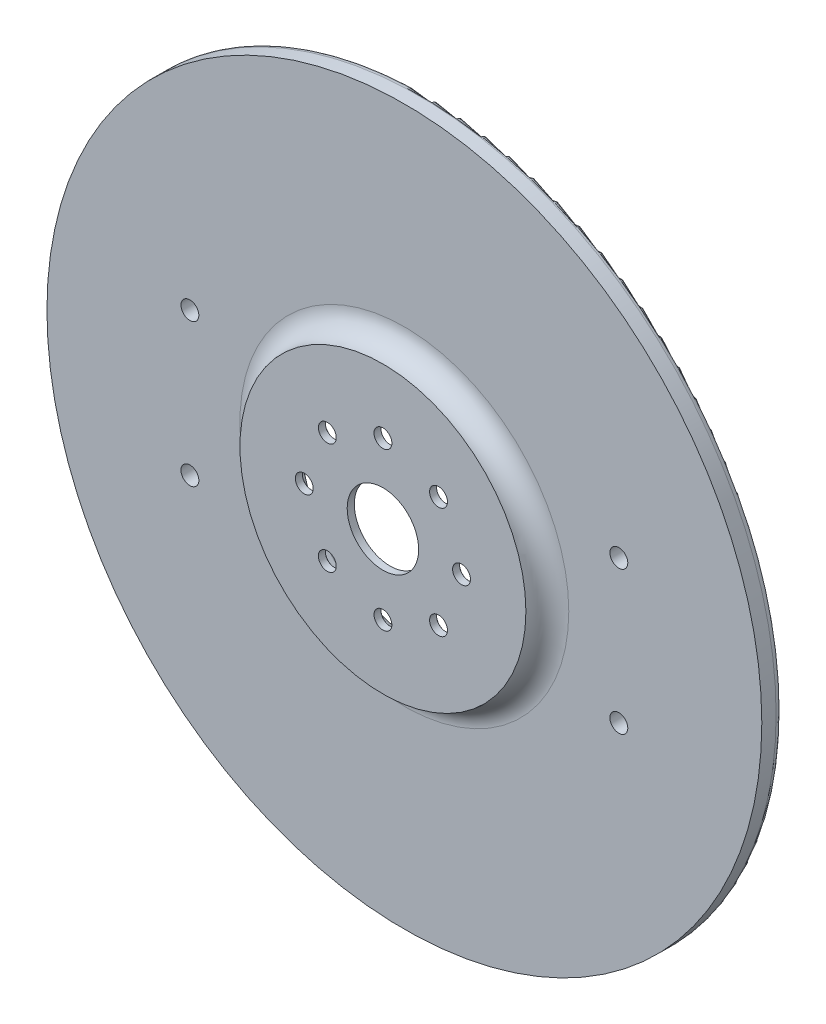
from build123d import *

# Parameters (mm, degrees)
SKETCH_1_R            = 50
EXTRUDE_1_DEPTH       = 3
F_2_5MM_1_D           = 2.5
F_2_5MM_1_CSINK_D     = 2.55
F_2_5MM_1_CSINK_ANGLE = 90
SKETCH_5_R            = 20
EXTRUDE_2_DEPTH       = 3
SKETCH_6_R            = 17
CUT_EXTRUDE_1_DEPTH   = 5
F_2_5MM_2_AT_2_COUNT  = 2
F_2_5MM_2_AT_2_PITCH  = 8.419035512
F_2_5MM_2_AT_3_COUNT  = 2
F_2_5MM_2_AT_3_PITCH  = 15.556349186
F_2_5MM_2_AT_4_COUNT  = 2
F_2_5MM_2_AT_4_PITCH  = 20.325349715
F_2_5MM_2_AT_5_COUNT  = 2
F_2_5MM_2_AT_5_PITCH  = 22
F_2_5MM_2_AT_6_COUNT  = 2
F_2_5MM_2_AT_6_PITCH  = 20.325349715
F_2_5MM_2_AT_7_COUNT  = 2
F_2_5MM_2_AT_7_PITCH  = 15.556349186
F_2_5MM_2_AT_8_COUNT  = 2
F_2_5MM_2_AT_8_PITCH  = 8.419035512
SKETCH_10_R           = 5
CUT_EXTRUDE_2_DEPTH   = 5
FILLET_1_R            = 1
FILLET_3_R            = 3


# Some blends are built 0.0001 mm under size
with BuildPart() as part:
    # 草图1 → 凸台-拉伸1 (new body)
    with BuildSketch(Plane.XY):
        Circle(SKETCH_1_R)
    extrude(amount=EXTRUDE_1_DEPTH)

    # Ø2.5mm 暗销孔1 (through all)
    with Locations(Plane(origin=(0, 0, 0), x_dir=(-1, 0, 0), z_dir=(0, 0, -1))):
        with Locations((-30, 10), (-30, -10), (30, -10), (30, 10)):
            CounterSinkHole(F_2_5MM_1_D / 2, F_2_5MM_1_CSINK_D / 2, counter_sink_angle=F_2_5MM_1_CSINK_ANGLE)

    # 草图5 → 凸台-拉伸2 (add)
    with BuildSketch(Plane.XY.offset(3)):
        Circle(SKETCH_5_R)
    extrude(amount=EXTRUDE_2_DEPTH)

    # 草图6 → 切除-拉伸1 (cut)
    with BuildSketch(Plane(origin=(0, 0, 0), x_dir=(-1, 0, 0), z_dir=(0, 0, -1))):
        Circle(SKETCH_6_R)
    extrude(amount=-CUT_EXTRUDE_1_DEPTH, mode=Mode.SUBTRACT)

    # 草图9 → Ø2.5mm 暗销孔2 (revolve, cut)
    with BuildSketch(Plane(origin=(11, 0, 5), x_dir=(0, 1, 0), z_dir=(1, 0, 0))):
        Polygon((0, 0), (0, 1), (1.25, 1), (1.25, 0.025), (1.275, 0), align=None)
    f_2_5mm_2 = revolve(axis=Axis((11, 0, -1.35), (0, 0, 1)), mode=Mode.SUBTRACT)

    # Ø2.5mm 暗销孔2 at 2: Ø2.5mm 暗销孔2 ×2
    with Locations(*[Vector(-0.38268343236200486, 0.9238795325125646, 0) * (i * F_2_5MM_2_AT_2_PITCH) for i in range(1, F_2_5MM_2_AT_2_COUNT)]):
        add(f_2_5mm_2, mode=Mode.SUBTRACT)

    # Ø2.5mm 暗销孔2 at 3: Ø2.5mm 暗销孔2 ×2
    with Locations(*[Vector(-0.7071067811841869, 0.7071067811889081, 0) * (i * F_2_5MM_2_AT_3_PITCH) for i in range(1, F_2_5MM_2_AT_3_COUNT)]):
        add(f_2_5mm_2, mode=Mode.SUBTRACT)

    # Ø2.5mm 暗销孔2 at 4: Ø2.5mm 暗销孔2 ×2
    with Locations(*[Vector(-0.9238795325100095, 0.3826834323681732, 0) * (i * F_2_5MM_2_AT_4_PITCH) for i in range(1, F_2_5MM_2_AT_4_COUNT)]):
        add(f_2_5mm_2, mode=Mode.SUBTRACT)

    # Ø2.5mm 暗销孔2 at 5: Ø2.5mm 暗销孔2 ×2
    with Locations(*[(-i * F_2_5MM_2_AT_5_PITCH, 0, 0) for i in range(1, F_2_5MM_2_AT_5_COUNT)]):
        add(f_2_5mm_2, mode=Mode.SUBTRACT)

    # Ø2.5mm 暗销孔2 at 6: Ø2.5mm 暗销孔2 ×2
    with Locations(*[Vector(-0.9238795325125633, -0.38268343236200797, 0) * (i * F_2_5MM_2_AT_6_PITCH) for i in range(1, F_2_5MM_2_AT_6_COUNT)]):
        add(f_2_5mm_2, mode=Mode.SUBTRACT)

    # Ø2.5mm 暗销孔2 at 7: Ø2.5mm 暗销孔2 ×2
    with Locations(*[Vector(-0.7071067811889058, -0.7071067811841893, 0) * (i * F_2_5MM_2_AT_7_PITCH) for i in range(1, F_2_5MM_2_AT_7_COUNT)]):
        add(f_2_5mm_2, mode=Mode.SUBTRACT)

    # Ø2.5mm 暗销孔2 at 8: Ø2.5mm 暗销孔2 ×2
    with Locations(*[Vector(-0.3826834323681702, -0.9238795325100109, 0) * (i * F_2_5MM_2_AT_8_PITCH) for i in range(1, F_2_5MM_2_AT_8_COUNT)]):
        add(f_2_5mm_2, mode=Mode.SUBTRACT)

    # 草图10 → 切除-拉伸2 (cut)
    with BuildSketch(Plane(origin=(0, 0, 5), x_dir=(-1, 0, 0), z_dir=(0, 0, -1))):
        Circle(SKETCH_10_R)
    extrude(amount=-CUT_EXTRUDE_2_DEPTH, mode=Mode.SUBTRACT)

    # 圆角1
    # the kernel refuses this fillet: 1 mm, written as the material it takes off along each edge
    with BuildSketch(Plane(origin=(-30, -10, 0), x_dir=(1, 0, 0), z_dir=(0, -1, 0))) as fillet_1_piece_1:
        with BuildLine():
            CenterArc((1.47220486, 1), FILLET_1_R, 257.161431859, 12.838568141)
            Line((1.25, 0.025), (1.245555903, 0.0055))
            ThreePointArc((1.245555903, 0.0055), (1.248357864, -0.001642136), (1.260857864, -0.014142136))
            Line((1.260857864, -0.014142136), (1.275, -0.02))
            Line((1.275, -0.02), (1.47220486, -0.02))
            Line((1.47220486, -0.02), (1.47220486, 0))
        make_face()
    revolve(axis=Axis((-30, -10, 0), (0, 0, 1)), mode=Mode.SUBTRACT)
    with BuildSketch(Plane(origin=(0, 0, 0), x_dir=(1, 0, 0), z_dir=(0, -1, 0))) as fillet_1_piece_2:
        with BuildLine():
            CenterArc((50 - FILLET_1_R, FILLET_1_R), FILLET_1_R, 270, 90)
            Line((50 - FILLET_1_R, 0), (50 - FILLET_1_R, -FILLET_1_R * 0.02))
            Line((50 - FILLET_1_R, -FILLET_1_R * 0.02), (50 + FILLET_1_R * 0.02, -FILLET_1_R * 0.02))
            Line((50 + FILLET_1_R * 0.02, -FILLET_1_R * 0.02), (50 + FILLET_1_R * 0.02, FILLET_1_R))
            Line((50 + FILLET_1_R * 0.02, FILLET_1_R), (50, FILLET_1_R))
        make_face()
    revolve(axis=Axis((0, 0, 0), (0, 0, 1)), mode=Mode.SUBTRACT)
    with BuildSketch(Plane(origin=(30, -10, 0), x_dir=(1, 0, 0), z_dir=(0, -1, 0))) as fillet_1_piece_3:
        with BuildLine():
            CenterArc((1.47220486, 1), FILLET_1_R, 257.161431859, 12.838568141)
            Line((1.25, 0.025), (1.245555903, 0.0055))
            ThreePointArc((1.245555903, 0.0055), (1.248357864, -0.001642136), (1.260857864, -0.014142136))
            Line((1.260857864, -0.014142136), (1.275, -0.02))
            Line((1.275, -0.02), (1.47220486, -0.02))
            Line((1.47220486, -0.02), (1.47220486, 0))
        make_face()
    revolve(axis=Axis((30, -10, 0), (0, 0, 1)), mode=Mode.SUBTRACT)
    with BuildSketch(Plane(origin=(30, 10, 0), x_dir=(1, 0, 0), z_dir=(0, -1, 0))) as fillet_1_piece_4:
        with BuildLine():
            CenterArc((1.47220486, 1), FILLET_1_R, 257.161431859, 12.838568141)
            Line((1.25, 0.025), (1.245555903, 0.0055))
            ThreePointArc((1.245555903, 0.0055), (1.248357864, -0.001642136), (1.260857864, -0.014142136))
            Line((1.260857864, -0.014142136), (1.275, -0.02))
            Line((1.275, -0.02), (1.47220486, -0.02))
            Line((1.47220486, -0.02), (1.47220486, 0))
        make_face()
    revolve(axis=Axis((30, 10, 0), (0, 0, 1)), mode=Mode.SUBTRACT)
    with BuildSketch(Plane(origin=(0, 0, 0), x_dir=(-1, 0, 0), z_dir=(0, -1, 0))) as fillet_1_piece_5:
        with BuildLine():
            CenterArc((17 + FILLET_1_R, -FILLET_1_R), FILLET_1_R, 90, 90)
            Line((17, -FILLET_1_R), (17 - FILLET_1_R * 0.02, -FILLET_1_R))
            Line((17 - FILLET_1_R * 0.02, -FILLET_1_R), (17 - FILLET_1_R * 0.02, FILLET_1_R * 0.02))
            Line((17 - FILLET_1_R * 0.02, FILLET_1_R * 0.02), (17 + FILLET_1_R, FILLET_1_R * 0.02))
            Line((17 + FILLET_1_R, FILLET_1_R * 0.02), (17 + FILLET_1_R, 0))
        make_face()
    revolve(axis=Axis((0, 0, 0), (0, 0, -1)), mode=Mode.SUBTRACT)
    with BuildSketch(Plane(origin=(-30, 10, 0), x_dir=(1, 0, 0), z_dir=(0, -1, 0))) as fillet_1_piece_6:
        with BuildLine():
            CenterArc((1.47220486, 1), FILLET_1_R, 257.161431859, 12.838568141)
            Line((1.25, 0.025), (1.245555903, 0.0055))
            ThreePointArc((1.245555903, 0.0055), (1.248357864, -0.001642136), (1.260857864, -0.014142136))
            Line((1.260857864, -0.014142136), (1.275, -0.02))
            Line((1.275, -0.02), (1.47220486, -0.02))
            Line((1.47220486, -0.02), (1.47220486, 0))
        make_face()
    revolve(axis=Axis((-30, 10, 0), (0, 0, 1)), mode=Mode.SUBTRACT)

    # 圆角3
    fillet_3_edges = [part.edges().sort_by_distance(p)[0] for p in [
        (-20, 0, 3),
    ]]
    fillet(fillet_3_edges, radius=FILLET_3_R - 0.0001)  # a hair under: the kernel refuses the full size


solid = part.part
